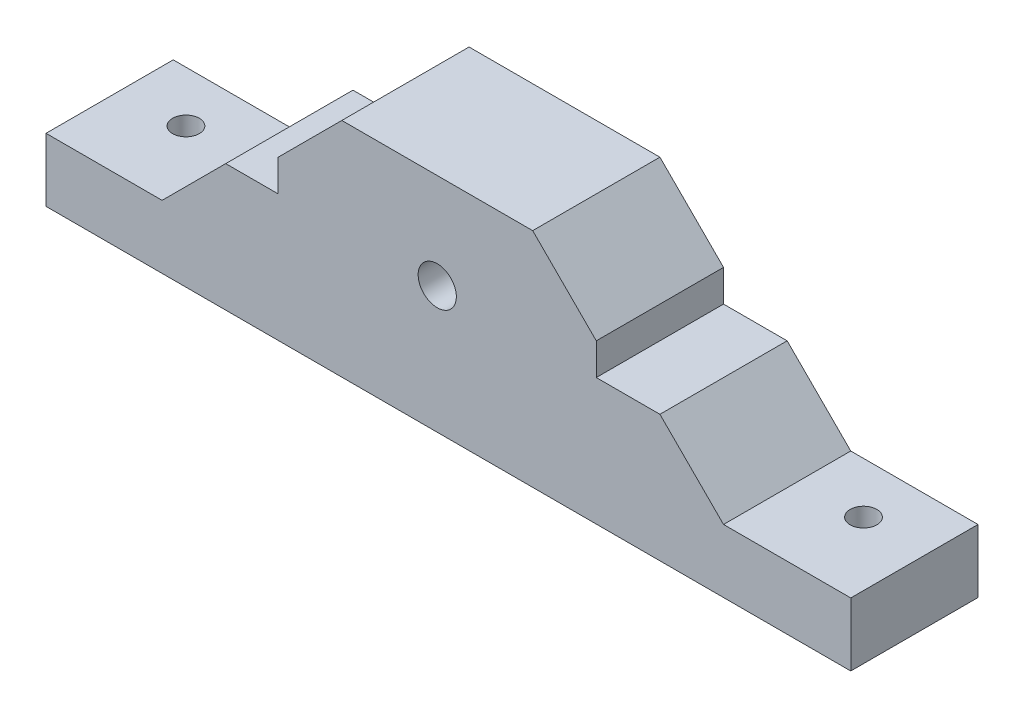
from build123d import *

# Parameters (mm, degrees)
SKETCH_1_W          = 126.5
SKETCH_1_H          = 20
SKETCH_1_R          = 2.1
EXTRUDE_1_DEPTH     = 40
SKETCH_2_R          = 3
CUT_EXTRUDE_1_DEPTH = 322.481529503
CHAMFER_1_SIZE      = 10
CHAMFER_2_SIZE      = 10


with BuildPart() as part:
    # Эскиз1 → Бобышка-Вытянуть1 (new body)
    with BuildSketch(Plane(origin=(0, 254.195974268, 0), x_dir=(1, 0, 0), z_dir=(0, 1, 0))):
        with Locations((64.808980694, -42.273129836)):
            Rectangle(SKETCH_1_W, SKETCH_1_H)
        with Locations(Location((11.55898069, -40.273129836, 0), (0, 0, 180))):
            Circle(SKETCH_1_R, mode=Mode.SUBTRACT)
        with Locations(Location((118.058980694, -40.273129836, 0), (0, 0, 180))):
            Circle(SKETCH_1_R, mode=Mode.SUBTRACT)
    extrude(amount=EXTRUDE_1_DEPTH)

    # Эскиз2 → Вырез-Вытянуть1 (cut, through all)
    with BuildSketch(Plane(origin=(0, 0, 32.273129836), x_dir=(-1, 0, 0), z_dir=(0, 0, -1))):
        with Locations(Location((-63.058980694, 274.145974268, 0), (0, 0, 90))):
            Circle(SKETCH_2_R)
        Polygon((-128.058980694, 294.195974268), (-128.058980694, 274.195974268), (-128.058980694, 264.145974268), (-108.058980694, 264.145974268), (-108.058980694, 274.145974268), (-88.058980694, 274.145974268), (-88.058980694, 289.145974268), (-38.058980694, 289.145974268), (-38.058980694, 274.145974268), (-19.808980694, 274.145974268), (-19.808980694, 264.145974268), (-1.558980694, 264.145974268), (-1.558980694, 274.195974268), (-1.558980694, 294.195974268), align=None)
    extrude(amount=-CUT_EXTRUDE_1_DEPTH, mode=Mode.SUBTRACT)

    # Фаска1
    chamfer_1_edges = [part.edges().sort_by_distance(p)[0] for p in [
        (38.058980694, 289.145974268, 42.273129836),
        (88.058980694, 289.145974268, 42.273129836),
    ]]
    chamfer(chamfer_1_edges, length=CHAMFER_1_SIZE)

    # Фаска2
    chamfer_2_edges = [part.edges().sort_by_distance(p)[0] for p in [
        (19.808980694, 274.145974268, 42.273129836),
        (108.058980694, 274.145974268, 42.273129836),
    ]]
    chamfer(chamfer_2_edges, length=CHAMFER_2_SIZE - 0.0001)  # a hair under: the kernel refuses the full size


solid = part.part
